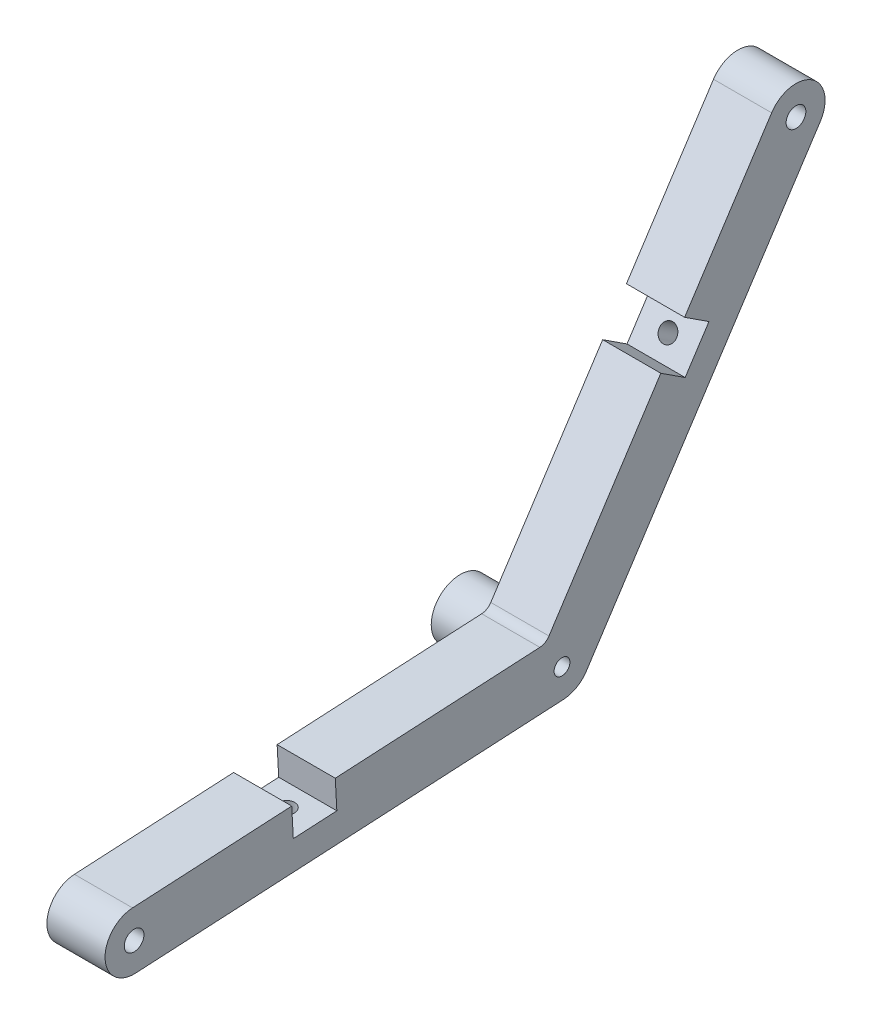
from build123d import *

# Parameters (mm, degrees)
BOSS_EXTRUDE1_DEPTH        = 12.7
CUT_EXTRUDE1_DEPTH         = 132.57770374
BOSS_EXTRUDE2_START        = 9.525
SKETCH6_R                  = 6.35
BOSS_EXTRUDE2_DEPTH        = 9.525
AXEL_HOLES_D               = 3.4544
LONG_AXEL_HOLES_D          = 4.3053
MOUNTING_HOLES_D           = 3.7973
MOUNTING_HOLES_ON_FACE_2_D = 3.7973
FILLET1_R                  = 2.54
CUT_EXTRUDE2_DEPTH         = 0.508


with BuildPart() as part:
    # Sketch1 → Boss-Extrude1 (new body)
    with BuildSketch(Plane(origin=(0, 0, 0), x_dir=(0, 0, -1), z_dir=(1, 0, 0))):
        with BuildLine():
            Line((-93.814317406, 1.29451642), (-3.560533752, 6.167025361))
            Line((-3.560533752, 6.167025361), (45.786074597, 81.892840322))
            ThreePointArc((45.786074597, 81.892840322), (54.573019473, 83.746107639), (56.42628679, 74.959162763))
            Line((56.42628679, 74.959162763), (5.320106096, -3.46683878))
            ThreePointArc((5.320106096, -3.46683878), (3.175, -5.499261314), (0.342317406, -6.34076642))
            Line((0.342317406, -6.34076642), (-93.129682594, -11.38701642))
            ThreePointArc((-93.129682594, -11.38701642), (-99.81276642, -5.388567406), (-93.814317406, 1.29451642))
        make_face()
    extrude(amount=BOSS_EXTRUDE1_DEPTH)

    # Sketch2 → Cut-Extrude1 (cut, through all)
    with BuildSketch(Plane(origin=(12.7, 0, 0), x_dir=(0, 0, -1), z_dir=(1, 0, 0))):
        Polygon((-59.042239928, 3.171748061), (-58.699922522, -3.169018359), (-49.188772892, -2.65554225), (-49.531090298, 3.68522417), align=None)
        Polygon((21.574047399, 44.73779456), (26.894153496, 41.270955781), (32.094411665, 49.251114925), (26.774305568, 52.717953705), align=None)
    extrude(amount=-CUT_EXTRUDE1_DEPTH, mode=Mode.SUBTRACT)

    # Sketch6 → Boss-Extrude2 (add)
    with BuildSketch(Plane.ZY.offset(BOSS_EXTRUDE2_START)):
        Circle(SKETCH6_R)
    extrude(amount=-BOSS_EXTRUDE2_DEPTH)

    # Axel Holes (through all)
    with Locations(Plane(origin=(12.7, 0, 0), x_dir=(0, 0, 1), z_dir=(1, 0, 0))):
        with Locations((0, 0)):
            Hole(AXEL_HOLES_D / 2)

    # Long Axel Holes (through all)
    with Locations(Plane(origin=(12.7, -5.04625, 93.472), x_dir=(0, 0, 1), z_dir=(1, 0, 0))):
        with Locations((0, 0), (-144.578180694, -83.472251543)):
            Hole(LONG_AXEL_HOLES_D / 2)

    # Mounting Holes (through all)
    with Locations(Plane(origin=(6.35, -2.912280304, 53.944347707), x_dir=(0, -0.053908252869, 0.998545892923), z_dir=(0, 0.998545892923, 0.053908252869))):
        with Locations((0, 0)):
            Hole(MOUNTING_HOLES_D / 2)

    # Mounting Holes on face 2 (through all)
    with Locations(Plane(origin=(6.35, 45.261035353, -29.49428258), x_dir=(0, 0.837811925843, -0.545958951676), z_dir=(0, 0.545958951676, 0.837811925843))):
        with Locations((0, 0)):
            Hole(MOUNTING_HOLES_ON_FACE_2_D / 2)

    # Fillet1
    fillet1_edges = [part.edges().sort_by_distance(p)[0] for p in [
        (6.35, 6.167025361, 3.560533752),
    ]]
    fillet(fillet1_edges, radius=FILLET1_R)

    # Sketch9 → Cut-Extrude2 (cut)
    # profile 1 of 6: a face of its own
    with BuildSketch(Plane.ZY):
        with BuildLine():
            Line((18.77313403, -0.80676972), (18.254303901, -1.206409143))
            add(Edge.make_bspline(
                [(18.254303901, -1.206409143), (18.235191824, -1.176363517), (18.198553976, -1.118766059), (18.13749504, -1.04154665), (18.077147395, -0.974310255), (18.014697553, -0.919038599), (17.951771868, -0.873827067), (17.886425218, -0.841751858), (17.820621038, -0.818283968), (17.775385801, -0.813395458), (17.753001818, -0.810976451)],
                knots=[0, 0, 0, 0, 1.288918017, 2.47085549, 3.561284224, 4.556692919, 5.486638184, 6.357330232, 7.187149354, 8, 8, 8, 8], degree=3))
            add(Edge.make_bspline(
                [(17.753001818, -0.810976451), (17.73215517, -0.810179654), (17.692054422, -0.80864693), (17.634337704, -0.819309388), (17.581300825, -0.836940191), (17.535567534, -0.865383015), (17.497445539, -0.898535261), (17.467032132, -0.934792365), (17.44823278, -0.975613885), (17.443862896, -1.004323243), (17.441703741, -1.018508502)],
                knots=[0, 0, 0, 0, 1.208652392, 2.324971526, 3.390143111, 4.438209403, 5.429575972, 6.318234147, 7.16904151, 8, 8, 8, 8], degree=3))
            add(Edge.make_bspline(
                [(17.441703741, -1.018508502), (17.441395191, -1.033034699), (17.440777289, -1.062124822), (17.449695224, -1.105389266), (17.46626522, -1.147585914), (17.481971468, -1.173894715), (17.490081145, -1.187478855)],
                knots=[0, 0, 0, 0, 0.97228079, 1.947086989, 2.940010329, 4, 4, 4, 4], degree=3))
            add(Edge.make_bspline(
                [(17.490081145, -1.187478855), (17.497673228, -1.198088326), (17.515316523, -1.22274375), (17.548608607, -1.262090082), (17.590876529, -1.31026043), (17.643663199, -1.365756008), (17.705102501, -1.430272766), (17.776284017, -1.502837252), (17.857398705, -1.582987602), (17.914924857, -1.639038269), (17.94510919, -1.668448406)],
                knots=[0, 0, 0, 0, 0.472277521, 1.097529013, 1.865031024, 2.793100552, 3.870564345, 5.091447245, 6.473864107, 8, 8, 8, 8], degree=3))
            add(Edge.make_bspline(
                [(17.94510919, -1.668448406), (17.973433852, -1.695510562), (18.027211718, -1.746891404), (18.102984569, -1.820700509), (18.170013945, -1.886415499), (18.228824605, -1.943996952), (18.277784832, -1.994354681), (18.319325742, -2.035586203), (18.350568379, -2.070002832), (18.368599629, -2.090279089), (18.376299094, -2.098937188)],
                knots=[0, 0, 0, 0, 1.542691334, 2.928989798, 4.165539925, 5.239346322, 6.169984195, 6.931424375, 7.543710995, 8, 8, 8, 8], degree=3))
            add(Edge.make_bspline(
                [(18.376299094, -2.098937188), (18.405550591, -2.134298644), (18.461669883, -2.202139953), (18.534443318, -2.306123365), (18.592500467, -2.407143315), (18.636440206, -2.506288464), (18.666976755, -2.605690053), (18.686788856, -2.7071729), (18.695389067, -2.812331355), (18.69254574, -2.88325608), (18.69110278, -2.919249688)],
                knots=[0, 0, 0, 0, 1.217584509, 2.335948177, 3.363739139, 4.305226759, 5.207659736, 6.117522017, 7.044660712, 8, 8, 8, 8], degree=3))
            add(Edge.make_bspline(
                [(18.69110278, -2.919249688), (18.687774133, -2.954159809), (18.681250354, -3.022579778), (18.660636441, -3.122195269), (18.631183691, -3.216672227), (18.59257797, -3.306077572), (18.54468538, -3.39009783), (18.487225036, -3.468148079), (18.421904903, -3.541621232), (18.347581659, -3.608462871), (18.26676714, -3.668627292), (18.180056987, -3.720076285), (18.08841871, -3.762349496), (17.991636797, -3.795435065), (17.889959997, -3.819364942), (17.783070463, -3.832829995), (17.671458634, -3.838975519), (17.595479915, -3.835358989), (17.556687716, -3.833512509)],
                knots=[0, 0, 0, 0, 1.029054621, 2.016833041, 2.980433847, 3.930105426, 4.870584851, 5.813489324, 6.770839681, 7.752161808, 8.74303381, 9.724499872, 10.706972885, 11.700834093, 12.722794947, 13.767989292, 14.860409806, 16, 16, 16, 16], degree=3))
            add(Edge.make_bspline(
                [(17.556687716, -3.833512509), (17.526247965, -3.830931088), (17.466276346, -3.825845239), (17.378365917, -3.81041994), (17.293444141, -3.791662711), (17.21249659, -3.764891629), (17.134396518, -3.734518971), (17.060124968, -3.697660286), (16.988591906, -3.656510569), (16.921364744, -3.608163464), (16.856116272, -3.555129753), (16.795630648, -3.493947893), (16.735978455, -3.428379191), (16.68122211, -3.354962409), (16.628027598, -3.276179875), (16.578842024, -3.19057415), (16.531224428, -3.099122554), (16.503220739, -3.0348817), (16.488879222, -3.00198206)],
                knots=[0, 0, 0, 0, 1.020423284, 2.010411903, 2.980450259, 3.923997158, 4.856586387, 5.778749418, 6.692338948, 7.61118841, 8.543221466, 9.498686242, 10.483299317, 11.503363845, 12.556154043, 13.658646142, 14.80092348, 16, 16, 16, 16], degree=3))
            Line((16.488879222, -3.00198206), (17.068706946, -2.704706419))
            add(Edge.make_bspline(
                [(17.068706946, -2.704706419), (17.086695445, -2.742480233), (17.121206212, -2.81494894), (17.182036591, -2.913051804), (17.244519446, -2.998373791), (17.31195521, -3.06816281), (17.3811503, -3.126167222), (17.456138262, -3.166563262), (17.533427195, -3.195941198), (17.587289748, -3.202188515), (17.614179703, -3.205307381)],
                knots=[0, 0, 0, 0, 1.290642822, 2.476086134, 3.558323041, 4.548265857, 5.466602666, 6.332061445, 7.167310298, 8, 8, 8, 8], degree=3))
            add(Edge.make_bspline(
                [(17.614179703, -3.205307381), (17.641586049, -3.206101679), (17.6949501, -3.207648292), (17.772244248, -3.192753763), (17.844047909, -3.166856381), (17.907835419, -3.127774818), (17.96116625, -3.079764057), (18.003852768, -3.026884166), (18.029895667, -2.966841764), (18.036003344, -2.924841268), (18.03905951, -2.903825009)],
                knots=[0, 0, 0, 0, 1.139510145, 2.218788178, 3.257219084, 4.306146572, 5.313090586, 6.236452936, 7.117554179, 8, 8, 8, 8], degree=3))
            add(Edge.make_bspline(
                [(18.03905951, -2.903825009), (18.039358319, -2.883900339), (18.039965916, -2.843385465), (18.026262392, -2.782118943), (18.001748557, -2.720807457), (17.973245113, -2.669123178), (17.942375054, -2.62625314), (17.913846841, -2.588040042), (17.877743898, -2.54637824), (17.835733407, -2.50002623), (17.786995794, -2.449861345), (17.733241165, -2.394008785), (17.672114423, -2.334750217), (17.628952932, -2.294029439), (17.606467363, -2.272815393)],
                knots=[0, 0, 0, 0, 0.907612601, 1.845541796, 2.842654207, 3.917849688, 4.530886748, 5.254653545, 6.095259128, 7.047416626, 8.111961071, 9.289585194, 10.587972353, 12, 12, 12, 12], degree=3))
            add(Edge.make_bspline(
                [(17.606467363, -2.272815393), (17.563524667, -2.232331299), (17.481139416, -2.154662857), (17.365442998, -2.040108644), (17.26128195, -1.933637529), (17.169497946, -1.834386968), (17.089785772, -1.742411806), (17.022416342, -1.657729082), (16.966598207, -1.580740903), (16.909118792, -1.489729597), (16.856156775, -1.379910304), (16.811730308, -1.249624773), (16.787572256, -1.120143323), (16.78897049, -1.034720387), (16.789660472, -0.992566996)],
                knots=[0, 0, 0, 0, 1.354345204, 2.598301468, 3.736146321, 4.772333228, 5.700212665, 6.528624142, 7.254980425, 7.881486032, 8.996887593, 10.043350711, 11.034458361, 12, 12, 12, 12], degree=3))
            add(Edge.make_bspline(
                [(16.789660472, -0.992566996), (16.792536459, -0.963026236), (16.798222389, -0.904623095), (16.817666709, -0.819362707), (16.844817243, -0.737698516), (16.880951852, -0.660314305), (16.924853635, -0.586358293), (16.977598322, -0.516628624), (17.038189024, -0.449934153), (17.107473032, -0.389259926), (17.181597421, -0.33324935), (17.260541013, -0.285385943), (17.343117186, -0.245675605), (17.429245772, -0.215162062), (17.51861492, -0.192253233), (17.611393844, -0.178534691), (17.707861181, -0.17258333), (17.773102899, -0.175618538), (17.806287075, -0.177162348)],
                knots=[0, 0, 0, 0, 0.981642698, 1.940742827, 2.887501802, 3.825496653, 4.762182592, 5.729206093, 6.714834093, 7.739550528, 8.773106404, 9.786753704, 10.790224071, 11.800826091, 12.806530532, 13.839362335, 14.901025548, 16, 16, 16, 16], degree=3))
            add(Edge.make_bspline(
                [(17.806287075, -0.177162348), (17.849219047, -0.181755109), (17.934350177, -0.190862235), (18.059222016, -0.222521345), (18.179621646, -0.269110221), (18.276406615, -0.320329992), (18.352591587, -0.369177843), (18.410457598, -0.41330926), (18.46887623, -0.463758751), (18.528698439, -0.519968545), (18.588985175, -0.582512009), (18.649857235, -0.651612195), (18.71244975, -0.726178266), (18.752576329, -0.779468169), (18.77313403, -0.80676972)],
                knots=[0, 0, 0, 0, 1.299919703, 2.577650808, 3.868610194, 5.18236558, 5.870030906, 6.594064525, 7.373271872, 8.195383111, 9.067047264, 9.990012652, 10.970240734, 12, 12, 12, 12], degree=3))
        make_face()
    # profile 2 of 6: a face of its own
    with BuildSketch(Plane.ZY):
        with BuildLine():
            add(Edge.make_bspline(
                [(19.680777927, -0.240140843), (19.708145687, -0.243422233), (19.762192153, -0.249902395), (19.838346445, -0.279809378), (19.907127737, -0.324293374), (19.966415801, -0.382411494), (20.016076655, -0.449577591), (20.049136222, -0.525329071), (20.067781533, -0.606382303), (20.066863973, -0.661886938), (20.066394914, -0.690261036)],
                knots=[0, 0, 0, 0, 1.002228841, 1.97922393, 2.95361121, 3.972672113, 4.992588711, 5.981233817, 6.968002061, 8, 8, 8, 8], degree=3))
            add(Edge.make_bspline(
                [(20.066394914, -0.690261036), (20.063042107, -0.718066651), (20.05649454, -0.772367173), (20.028180016, -0.849433654), (19.984583512, -0.918607004), (19.927010341, -0.97773066), (19.861406435, -1.0275207), (19.787687221, -1.060362469), (19.709644666, -1.080279305), (19.656122854, -1.079220932), (19.628894914, -1.07868251)],
                knots=[0, 0, 0, 0, 1.032416073, 2.016165795, 3.005964766, 4.03240102, 5.051724989, 6.029693268, 6.997653649, 8, 8, 8, 8], degree=3))
            add(Edge.make_bspline(
                [(19.628894914, -1.07868251), (19.601054655, -1.075429002), (19.546305713, -1.069030854), (19.469283355, -1.038983619), (19.399662021, -0.994722307), (19.34014204, -0.935780536), (19.291765884, -0.866980503), (19.25835348, -0.790717057), (19.239766353, -0.708683888), (19.240696971, -0.652491959), (19.241174561, -0.623654465)],
                knots=[0, 0, 0, 0, 1.008963322, 1.984165238, 2.955999834, 3.970843705, 4.989542447, 5.976114504, 6.961349326, 8, 8, 8, 8], degree=3))
            add(Edge.make_bspline(
                [(19.241174561, -0.623654465), (19.244466349, -0.596285666), (19.250930916, -0.542537539), (19.280373339, -0.466892695), (19.322912105, -0.398147588), (19.379972384, -0.339148066), (19.446330861, -0.290982855), (19.519925229, -0.257325705), (19.598994338, -0.238773696), (19.653107831, -0.239678292), (19.680777927, -0.240140843)],
                knots=[0, 0, 0, 0, 1.01799005, 1.999176424, 2.979598098, 3.996445519, 5.020312734, 6.000810905, 6.977745637, 8, 8, 8, 8], degree=3))
        make_face()
    # profile 3 of 6: a face of its own
    with BuildSketch(Plane.ZY):
        Polygon((19.284644112, -1.278502222), (19.932480651, -1.322672895), (19.757200202, -3.897192126), (19.109363664, -3.853021452), align=None)
    # profile 4 of 6: a face of its own
    with BuildSketch(Plane.ZY):
        Polygon((20.407898164, -1.355719), (22.383659382, -1.490334385), (21.086584062, -3.438751853), (22.17963294, -3.513771885), (22.142473485, -4.060646885), (20.055233901, -3.91831916), (21.357918196, -1.969901692), (20.370738709, -1.902594), align=None)
    # profile 5 of 6: a face of its own
    with BuildSketch(Plane.ZY):
        with BuildLine():
            Line((25.236849188, -3.167759094), (23.161528675, -3.026132491))
            add(Edge.make_bspline(
                [(23.161528675, -3.026132491), (23.164190159, -3.04862794), (23.169438197, -3.092985514), (23.183726659, -3.157688239), (23.202480386, -3.219446302), (23.226355214, -3.277936622), (23.255414364, -3.332990721), (23.288970625, -3.385037784), (23.3279831, -3.433644512), (23.371219996, -3.479081547), (23.418894355, -3.520725652), (23.471210538, -3.556927478), (23.526388569, -3.589656686), (23.586154073, -3.616052821), (23.648998112, -3.638882689), (23.716118231, -3.65511045), (23.786289955, -3.668251948), (23.834551821, -3.672503611), (23.859144861, -3.674670152)],
                knots=[0, 0, 0, 0, 1.038938112, 2.048626619, 3.035794787, 3.997707277, 4.942732215, 5.888669487, 6.834971446, 7.798317665, 8.763810487, 9.733760138, 10.714147582, 11.70288735, 12.72727699, 13.778102905, 14.867776776, 16, 16, 16, 16], degree=3))
            add(Edge.make_bspline(
                [(23.859144861, -3.674670152), (23.888830838, -3.675999804), (23.947336622, -3.678620313), (24.034181896, -3.671631474), (24.118595953, -3.658080629), (24.200212463, -3.635240855), (24.279301917, -3.605153205), (24.355354353, -3.566233774), (24.428693627, -3.519003009), (24.47457182, -3.482279253), (24.497866816, -3.463632491)],
                knots=[0, 0, 0, 0, 1.031919621, 2.033730218, 3.021946198, 3.999420381, 4.973953666, 5.958456861, 6.963391189, 8, 8, 8, 8], degree=3))
            Line((24.497866816, -3.463632491), (25.025811528, -3.756701402))
            add(Edge.make_bspline(
                [(25.025811528, -3.756701402), (25.006907362, -3.779135097), (24.969786109, -3.823187129), (24.910183706, -3.884641903), (24.848970488, -3.941202011), (24.785206777, -3.9928693), (24.719479566, -4.039810348), (24.651332351, -4.081992648), (24.581059195, -4.119217248), (24.508523763, -4.151759999), (24.433165896, -4.178912347), (24.355308987, -4.202253037), (24.274259062, -4.220537525), (24.190125673, -4.233568222), (24.103076797, -4.2426521), (24.012995062, -4.247689018), (23.919848907, -4.247565876), (23.856797662, -4.244258026), (23.824789893, -4.242578806)],
                knots=[0, 0, 0, 0, 1.040655806, 2.043488669, 3.035289691, 3.996243377, 4.95346881, 5.899275925, 6.837784474, 7.773210643, 8.717598966, 9.677872609, 10.655568167, 11.663052984, 12.696946909, 13.759961064, 14.862851222, 16, 16, 16, 16], degree=3))
            add(Edge.make_bspline(
                [(23.824789893, -4.242578806), (23.775602902, -4.238043397), (23.678972535, -4.229133356), (23.538518648, -4.201691504), (23.406088741, -4.162460598), (23.281708957, -4.111517352), (23.164617894, -4.049845011), (23.055617721, -3.97589969), (22.954748613, -3.890390776), (22.862720064, -3.794558106), (22.780180044, -3.690781093), (22.709787246, -3.580283934), (22.651808226, -3.464414935), (22.606393514, -3.343556019), (22.572082354, -3.21759147), (22.551479756, -3.086203561), (22.542758787, -2.9495441), (22.546729351, -2.857160449), (22.548748227, -2.810186979)],
                knots=[0, 0, 0, 0, 1.102216657, 2.165361151, 3.188833051, 4.180972237, 5.161242311, 6.138035006, 7.115384913, 8.107976714, 9.099635628, 10.070824604, 11.027483791, 11.986828213, 12.948708882, 13.936847851, 14.9509679, 16, 16, 16, 16], degree=3))
            add(Edge.make_bspline(
                [(22.548748227, -2.810186979), (22.55295805, -2.762150976), (22.561228327, -2.667783332), (22.589367439, -2.530603326), (22.627497323, -2.400067779), (22.678358932, -2.277219609), (22.73969882, -2.160978245), (22.812744691, -2.052139813), (22.897803723, -1.950414597), (22.993166593, -1.856526914), (23.096924193, -1.772226403), (23.206541841, -1.699312196), (23.321981958, -1.640166194), (23.442354412, -1.59275377), (23.568179343, -1.558534954), (23.698979853, -1.536793815), (23.834987688, -1.527282975), (23.927154655, -1.531364158), (23.974128836, -1.53344419)],
                knots=[0, 0, 0, 0, 1.080545129, 2.122751556, 3.134250897, 4.125992569, 5.098944999, 6.077190303, 7.059568296, 8.067585889, 9.073530491, 10.053234733, 11.014257358, 11.976779295, 12.949407024, 13.932483751, 14.946261491, 16, 16, 16, 16], degree=3))
            add(Edge.make_bspline(
                [(23.974128836, -1.53344419), (24.023565749, -1.53788835), (24.120508896, -1.546603112), (24.261025895, -1.575228795), (24.393991817, -1.614446906), (24.519066814, -1.665300534), (24.635846879, -1.729299662), (24.744752643, -1.804341264), (24.845806602, -1.89132682), (24.937803573, -1.989336681), (25.020561251, -2.096057542), (25.091046302, -2.211033005), (25.148899086, -2.333021922), (25.193671186, -2.462189772), (25.226769496, -2.597857487), (25.24686732, -2.740602635), (25.254892927, -2.890332679), (25.249912367, -2.992253702), (25.247366015, -3.044361658)],
                knots=[0, 0, 0, 0, 1.070966621, 2.100108385, 3.089905239, 4.060651398, 5.009003526, 5.959353612, 6.911095761, 7.881986159, 8.856919634, 9.821825796, 10.78783953, 11.766057902, 12.768354074, 13.798052314, 14.874236252, 16, 16, 16, 16], degree=3))
            Line((25.247366015, -3.044361658), (25.236849188, -3.167759094))
        make_face()
        with BuildLine():
            add(Edge.make_bspline(
                [(24.622666496, -2.614573998), (24.612895871, -2.578845251), (24.593648124, -2.508461026), (24.543579376, -2.410543737), (24.477816018, -2.322017268), (24.395916134, -2.244677829), (24.302893975, -2.178608037), (24.198895488, -2.129317856), (24.086586157, -2.095246326), (24.00801574, -2.086762779), (23.967818739, -2.082422556)],
                knots=[0, 0, 0, 0, 0.979981346, 1.930524694, 2.895978807, 3.89087358, 4.905166819, 5.908497695, 6.929977436, 8, 8, 8, 8], degree=3))
            add(Edge.make_bspline(
                [(23.967818739, -2.082422556), (23.945623744, -2.081451695), (23.901933937, -2.079540602), (23.836947219, -2.081358458), (23.773679177, -2.089343075), (23.711953795, -2.101757934), (23.652305138, -2.119570118), (23.594143025, -2.141200932), (23.537923799, -2.168678773), (23.502107717, -2.190571944), (23.484044701, -2.201613261)],
                knots=[0, 0, 0, 0, 1.051109057, 2.069058803, 3.071756596, 4.065080027, 5.044891597, 6.014351097, 6.998583688, 8, 8, 8, 8], degree=3))
            add(Edge.make_bspline(
                [(23.484044701, -2.201613261), (23.461250518, -2.21822539), (23.412477516, -2.253770572), (23.347099834, -2.326022694), (23.282736666, -2.415413127), (23.244293068, -2.48327387), (23.223928515, -2.519221434)],
                knots=[0, 0, 0, 0, 0.814843359, 1.743530634, 2.804690727, 4, 4, 4, 4], degree=3))
            Line((23.223928515, -2.519221434), (24.622666496, -2.614573998))
        make_face(mode=Mode.SUBTRACT)
    # profile 6 of 6: a face of its own
    with BuildSketch(Plane.ZY):
        Polygon((27.721679828, -0.947715868), (28.713767168, -1.01502356), (28.476788001, -4.496093272), (27.818434636, -4.451221477), (28.013346495, -1.592747919), (27.29680002, -1.543669394), align=None)
    extrude(amount=-CUT_EXTRUDE2_DEPTH, mode=Mode.SUBTRACT)


solid = part.part
